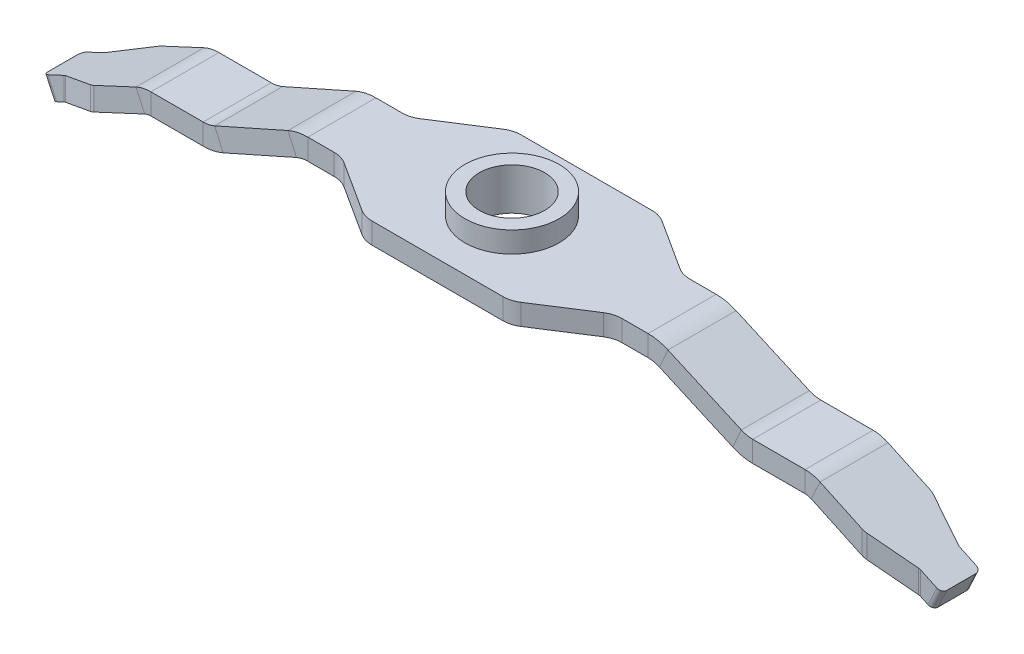
from build123d import *

# Parameters (mm, degrees)
BOSS_EXTRUDE1_DEPTH   = 0.8
SWEEP1_START          = -1.3
SWEEP1_DEPTH          = 2.6
SWEEP2_START          = -1.3
SWEEP2_DEPTH          = 2.6
CUT_EXTRUDE1_DEPTH    = 18.918364565
MIRROR3_COPY_1_DEPTH  = 18.918364565
SKETCH5_R             = 1.8
SKETCH5_R_2           = 1.2
BOSS_EXTRUDE2_DEPTH   = 0.8
M3X0_5_TAPPED_HOLE1_D = 2.5
FILLET1_R             = 0.2


# Read off the part's stored shape, not the designer's step: Sweep1, Sweep2
with BuildPart() as part:
    # Sketch1 → Boss-Extrude1 (new body)
    with BuildSketch(Plane(origin=(0, 0, 0), x_dir=(1, 0, 0), z_dir=(0, 1, 0))):
        with BuildLine():
            Line((-2.5, 2.85), (2.5, 2.85))
            ThreePointArc((2.5, 2.85), (2.78163021, 2.809523019), (3.040461339, 2.691368849))
            Line((3.040461339, 2.691368849), (4.959538661, 1.458631151))
            ThreePointArc((4.959538661, 1.458631151), (5.21836979, 1.340476981), (5.5, 1.3))
            Line((5.5, 1.3), (5.5, -1.3))
            ThreePointArc((5.5, -1.3), (5.21836979, -1.340476981), (4.959538661, -1.458631151))
            Line((4.959538661, -1.458631151), (3.040461339, -2.691368849))
            ThreePointArc((3.040461339, -2.691368849), (2.78163021, -2.809523019), (2.5, -2.85))
            Line((2.5, -2.85), (-2.5, -2.85))
            ThreePointArc((-2.5, -2.85), (-2.78163021, -2.809523019), (-3.040461339, -2.691368849))
            Line((-3.040461339, -2.691368849), (-4.959538661, -1.458631151))
            ThreePointArc((-4.959538661, -1.458631151), (-5.21836979, -1.340476981), (-5.5, -1.3))
            Line((-5.5, -1.3), (-5.5, 1.3))
            ThreePointArc((-5.5, 1.3), (-5.21836979, 1.340476981), (-4.959538661, 1.458631151))
            Line((-4.959538661, 1.458631151), (-3.040461339, 2.691368849))
            ThreePointArc((-3.040461339, 2.691368849), (-2.78163021, 2.809523019), (-2.5, 2.85))
        make_face()
    extrude(amount=-BOSS_EXTRUDE1_DEPTH)

    # Sweep1 outline → Sweep1 (add)
    with BuildSketch(Plane.XY.offset(SWEEP1_START)):
        with BuildLine():
            Line((-13.071251863, -1.626643489), (-17.169047305, -3.537476885))
            Line((-17.169047305, -3.537476885), (-16.830952695, -4.262523115))
            Line((-16.830952695, -4.262523115), (-12.733157253, -2.351689719))
            ThreePointArc((-12.733157253, -2.351689719), (-12.619409099, -2.313077423), (-12.5, -2.3))
            Line((-12.5, -2.3), (-10.5, -2.3))
            ThreePointArc((-10.5, -2.3), (-10.110231056, -2.259075901), (-9.737462135, -2.138088534))
            Line((-9.737462135, -2.138088534), (-6.937462135, -0.892887369))
            ThreePointArc((-6.937462135, -0.892887369), (-6.723607459, -0.823477842), (-6.5, -0.8))
            Line((-6.5, -0.8), (-5.5, -0.8))
            Line((-5.5, -0.8), (-5.5, 0))
            Line((-5.5, 0), (-6.5, 0))
            ThreePointArc((-6.5, 0), (-6.889768944, -0.040924099), (-7.262537865, -0.161911466))
            Line((-7.262537865, -0.161911466), (-10.062537865, -1.407112631))
            ThreePointArc((-10.062537865, -1.407112631), (-10.276392541, -1.476522158), (-10.5, -1.5))
            Line((-10.5, -1.5), (-12.5, -1.5))
            ThreePointArc((-12.5, -1.5), (-12.79256079, -1.532040618), (-13.071251863, -1.626643489))
        make_face()
    extrude(amount=SWEEP1_DEPTH)

    # Sweep2 outline → Sweep2 (add)
    with BuildSketch(Plane.XY.offset(SWEEP2_START)):
        with BuildLine():
            ThreePointArc((13.071251863, -1.626643489), (12.79256079, -1.532040618), (12.5, -1.5))
            Line((12.5, -1.5), (10.5, -1.5))
            ThreePointArc((10.5, -1.5), (10.276392541, -1.476522158), (10.062537865, -1.407112631))
            Line((10.062537865, -1.407112631), (7.262537865, -0.161911466))
            ThreePointArc((7.262537865, -0.161911466), (6.889768944, -0.040924099), (6.5, 0))
            Line((6.5, 0), (5.5, 0))
            Line((5.5, 0), (5.5, -0.8))
            Line((5.5, -0.8), (6.5, -0.8))
            ThreePointArc((6.5, -0.8), (6.723607459, -0.823477842), (6.937462135, -0.892887369))
            Line((6.937462135, -0.892887369), (9.737462135, -2.138088534))
            ThreePointArc((9.737462135, -2.138088534), (10.110231056, -2.259075901), (10.5, -2.3))
            Line((10.5, -2.3), (12.5, -2.3))
            ThreePointArc((12.5, -2.3), (12.619409099, -2.313077423), (12.733157253, -2.351689719))
            Line((12.733157253, -2.351689719), (16.830952695, -4.262523115))
            Line((16.830952695, -4.262523115), (17.169047305, -3.537476885))
            Line((17.169047305, -3.537476885), (13.071251863, -1.626643489))
        make_face()
    extrude(amount=SWEEP2_DEPTH)

    # Sketch3 → Cut-Extrude1 (cut, through all)
    with BuildSketch(Plane(origin=(0, 0, 0), x_dir=(1, 0, 0), z_dir=(0, 1, 0))):
        with BuildLine():
            Line((-17.169047305, 0.75), (-16.369047305, 0.75))
            ThreePointArc((-16.369047305, 0.75), (-16.335739791, 0.752792978), (-16.303362548, 0.761093905))
            Line((-16.303362548, 0.761093905), (-14.833259195, 1.272265238))
            ThreePointArc((-14.833259195, 1.272265238), (-14.75231609, 1.293017555), (-14.669047305, 1.3))
            Line((-14.669047305, 1.3), (-17.169047305, 1.3))
            Line((-17.169047305, 1.3), (-17.169047305, 0.75))
        make_face()
    cut_extrude1 = extrude(amount=-CUT_EXTRUDE1_DEPTH, mode=Mode.SUBTRACT)

    # Mirror1: Cut-Extrude1 across plane
    add(cut_extrude1.mirror(Plane.XY), mode=Mode.SUBTRACT)

    # Mirror3: Cut-Extrude1 across plane
    add(cut_extrude1.mirror(Plane(origin=(0, 0, 0), x_dir=(0, 0, 1), z_dir=(1, 0, 0))), mode=Mode.SUBTRACT)

    # Mirror3 copy 1 sketch → Mirror3 copy 1 (cut, through all)
    with BuildSketch(Plane(origin=(0, 0, 0), x_dir=(-1, 0, 0), z_dir=(0, 1, 0))):
        with BuildLine():
            Line((-17.169047305, 0.75), (-16.369047305, 0.75))
            ThreePointArc((-16.369047305, 0.75), (-16.335739791, 0.752792978), (-16.303362548, 0.761093905))
            Line((-16.303362548, 0.761093905), (-14.833259195, 1.272265238))
            ThreePointArc((-14.833259195, 1.272265238), (-14.75231609, 1.293017555), (-14.669047305, 1.3))
            Line((-14.669047305, 1.3), (-17.169047305, 1.3))
            Line((-17.169047305, 1.3), (-17.169047305, 0.75))
        make_face()
    extrude(amount=-MIRROR3_COPY_1_DEPTH, mode=Mode.SUBTRACT)

    # Sketch5 → Boss-Extrude2 (add)
    with BuildSketch(Plane(origin=(0, 0, 0), x_dir=(1, 0, 0), z_dir=(0, 1, 0))):
        with Locations(Location((0, 0, 0), (0, 0, 270))):
            Circle(SKETCH5_R)
        with Locations(Location((0, 0, 0), (0, 0, 270))):
            Circle(SKETCH5_R_2, mode=Mode.SUBTRACT)
    extrude(amount=BOSS_EXTRUDE2_DEPTH)

    # M3x0.5 Tapped Hole1 (through all)
    with Locations(Plane(origin=(0, 0.8, 0), x_dir=(1, 0, 0), z_dir=(0, 1, 0))):
        with Locations((0, 0)):
            Hole(M3X0_5_TAPPED_HOLE1_D / 2)

    # Fillet1
    fillet1_edges = [part.edges().sort_by_distance(p)[0] for p in [
        (-17, -3.9, -0.75),
        (-17, -3.9, 0.75),
        (17, -3.9, -0.75),
        (17, -3.9, 0.75),
    ]]
    fillet(fillet1_edges, radius=FILLET1_R)


solid = part.part
